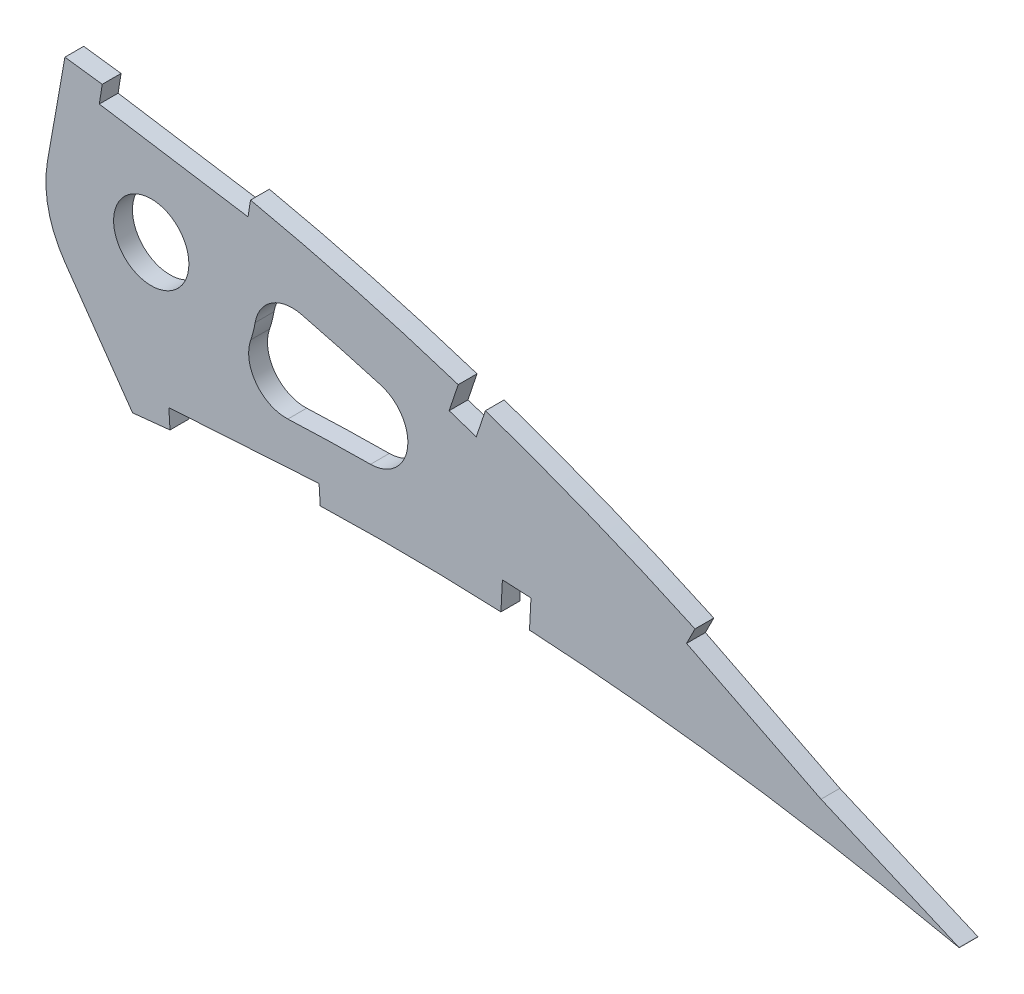
from build123d import *

# Parameters (mm, degrees)
BOSS_EXTRUDE1_DEPTH = 3.175
SKETCH5_R           = 6.35
CUT_EXTRUDE5_DEPTH  = 495.005666426
CUT_EXTRUDE6_DEPTH  = 7.62
FILLET1_R           = 6.35


with BuildPart() as part:
    # Sketch1 → Boss-Extrude1 (new body)
    with BuildSketch(Plane.XY):
        with BuildLine():
            Line((485.587399664, -0.75798934), (490.147728055, -1.684578565))
            Line((490.147728055, -1.684578565), (486.193791136, 0.75798934))
            add(Edge.make_bspline(
                [(486.193791136, 0.75798934), (486.156545565, 0.780998011), (486.007707871, 0.872943377), (485.672349582, 1.078647636), (485.113908292, 1.42125844), (484.332139179, 1.898395939), (483.327649378, 2.508793191), (482.099933618, 3.248176053), (480.649758178, 4.11414228), (478.977474042, 5.102596174), (477.083252712, 6.208909725), (474.9678154, 7.428600903), (472.631346146, 8.754764469), (470.074750091, 10.181981707), (467.298904376, 11.703464898), (464.304334104, 13.312342155), (461.092111509, 15.00042968), (457.663469746, 16.760467008), (454.019033833, 18.582734695), (450.160522056, 20.459648763), (446.08922006, 22.381851369), (441.806517314, 24.339086509), (437.314874314, 26.32337623), (432.615532729, 28.322383702), (427.711170694, 30.327448406), (422.603876177, 32.32715893), (417.296673201, 34.312408193), (411.791609239, 36.270335128), (406.092799427, 38.19238362), (400.203008281, 40.066067188), (394.126447785, 41.881210299), (387.866648542, 43.626044211), (381.42882875, 45.291620487), (374.81707141, 46.865809768), (368.036980395, 48.338075006), (361.093945075, 49.699552264), (353.993788332, 50.936649002), (346.7561854, 52.048400815), (339.497587697, 52.97319004), (332.253923966, 53.880196397), (325.021047815, 54.732245847), (317.699770737, 55.548201081), (310.297136308, 56.323468086), (302.820487344, 57.055622539), (295.277392798, 57.741504683), (287.675691417, 58.379102964), (280.022738792, 58.964804598), (272.326604726, 59.497707184), (264.594897726, 59.973125915), (256.835853078, 60.39070372), (249.05734719, 60.747528421), (241.267474913, 61.041141246), (233.474507978, 61.269769861), (225.686535745, 61.431223873), (217.911990598, 61.524488163), (210.158959277, 61.547014441), (202.435870244, 61.498399603), (194.750810842, 61.376974546), (187.112218127, 61.181076903), (179.528190462, 60.910341158), (172.006928802, 60.56488465), (164.556668167, 60.141814477), (157.185490761, 59.643826715), (149.90160498, 59.068829465), (142.713013757, 58.416669795), (135.627250794, 57.690066178), (128.652204991, 56.887042275), (121.795351463, 56.009883049), (115.064190238, 55.060308222), (108.466273869, 54.03780049), (102.008670179, 52.945313451), (95.69834878, 51.783964779), (89.541985966, 50.557159213), (83.546284377, 49.265216856), (77.717590812, 47.912013041), (72.061962755, 46.499905586), (66.585479912, 45.031479446), (61.293693841, 43.510258272), (56.191955701, 41.93969324), (51.286212878, 40.321510147), (46.580173058, 38.661844322), (42.079617138, 36.961873954), (37.787992638, 35.226836263), (33.71032906, 33.459100147), (29.849672544, 31.664054679), (26.210392495, 29.843743399), (22.795082621, 28.003266258), (19.607171667, 26.145445317), (16.649728276, 24.273731457), (13.923995526, 22.392872215), (11.433731376, 20.504048278), (9.179791317, 18.61203256), (7.163601692, 16.719706143), (5.388044474, 14.828372521), (3.853055719, 12.941362387), (2.560647106, 11.060170164), (1.511042845, 9.186575935), (0.706617001, 7.321940679), (0.14657185, 5.467313049), (-0.159993132, 3.625430402), (-0.236298987, 1.794816138), (-0.078648638, 0.597378122), (0, 0)],
                knots=[0, 0, 0, 0, 0.00025409, 0.001015373, 0.002283359, 0.004056577, 0.006330982, 0.009105274, 0.012374489, 0.016134023, 0.020379661, 0.025105976, 0.030306237, 0.035972206, 0.042099522, 0.048678064, 0.055701664, 0.063160184, 0.071045824, 0.079349827, 0.08806291, 0.097175757, 0.106678111, 0.116561573, 0.126814276, 0.137428301, 0.148393618, 0.15969976, 0.171338125, 0.183297699, 0.195569604, 0.208143556, 0.221011593, 0.234161831, 0.24758745, 0.261276822, 0.27522271, 0.289414144, 0.3037712, 0.317689226, 0.331784111, 0.346039677, 0.36044387, 0.374982721, 0.389640454, 0.404403317, 0.4192566, 0.434186749, 0.449177265, 0.464214782, 0.479284009, 0.49436974, 0.509457833, 0.524532346, 0.53957932, 0.554582984, 0.569529546, 0.584403417, 0.599190992, 0.613876838, 0.628447475, 0.642888675, 0.657186054, 0.671325546, 0.685294014, 0.699078147, 0.712665095, 0.726042645, 0.739197713, 0.752117586, 0.764792042, 0.777208152, 0.789355685, 0.80122396, 0.812803686, 0.824082909, 0.835054602, 0.845709571, 0.856037853, 0.866033834, 0.875688843, 0.884997719, 0.893953426, 0.902552897, 0.910789386, 0.918660734, 0.926166253, 0.933302626, 0.94007122, 0.94647478, 0.952517526, 0.958204819, 0.963546652, 0.9685566, 0.973249913, 0.977651041, 0.981787043, 0.985694226, 0.989415109, 0.993001157, 0.996508416, 1, 1, 1, 1], degree=3))
            add(Edge.make_bspline(
                [(0, 0), (0.124852845, -0.589388692), (0.375132337, -1.770874799), (1.055109044, -3.471725282), (1.954345773, -5.106735278), (3.091715472, -6.671561797), (4.459655687, -8.165777182), (6.055145152, -9.59093561), (7.876619233, -10.946270738), (9.92169391, -12.231165798), (12.187398396, -13.446984767), (14.671186068, -14.592971696), (17.370792198, -15.668768481), (20.283275494, -16.672937055), (23.405075375, -17.607006726), (26.733223776, -18.468701274), (30.263936284, -19.259225009), (33.993816996, -19.976560109), (37.918801514, -20.621435301), (42.034812323, -21.193489669), (46.337624631, -21.693081077), (50.82301706, -22.119161118), (55.4865531, -22.47264634), (60.323584549, -22.753771214), (65.329416188, -22.963427152), (70.499252954, -23.100817142), (75.828031579, -23.168083162), (81.310936338, -23.16623498), (86.942603653, -23.09477832), (92.718222737, -22.957660649), (98.632251256, -22.754013473), (104.679350026, -22.486301136), (110.854064483, -22.157217858), (117.150856575, -21.767879174), (123.564184912, -21.320010643), (130.088480981, -20.817203984), (136.717818035, -20.260713235), (143.446414433, -19.653782206), (150.268313286, -18.999449162), (157.177620607, -18.29978506), (164.168237687, -17.558081099), (171.233938121, -16.77674083), (178.368711149, -15.959932594), (185.566039209, -15.10913432), (192.819836156, -14.229203613), (200.123278023, -13.321821748), (207.470257634, -12.390483576), (214.854167095, -11.43957439), (222.268093801, -10.46898568), (229.705802131, -9.485632582), (237.16011938, -8.488705064), (244.624557097, -7.483330472), (252.092205531, -6.472633763), (259.555791095, -5.456925983), (267.00875308, -4.440416464), (274.444177456, -3.425895825), (281.854781181, -2.413456633), (289.233859631, -1.408131206), (296.573982386, -0.40979664), (303.868380953, 0.579523), (311.110065241, 1.55687475), (318.292203182, 2.521024953), (325.407385919, 3.471363717), (332.448454941, 4.408247897), (339.302915498, 5.303240759), (345.952856872, 6.204000824), (352.420688138, 6.942424504), (358.80798662, 7.572695641), (365.121387221, 8.089431053), (371.353308903, 8.500064921), (377.496611311, 8.807531395), (383.543972889, 9.016123146), (389.487754946, 9.132028332), (395.320533551, 9.158188245), (401.034347101, 9.102945563), (406.621764277, 8.970753247), (412.074986888, 8.767544827), (417.386407281, 8.500176147), (422.548480993, 8.175935919), (427.553458197, 7.799606866), (432.394364707, 7.379974648), (437.06373176, 6.923182232), (441.554389355, 6.434448486), (445.859785012, 5.92401425), (449.973027478, 5.395240442), (453.887929886, 4.85681652), (457.598190253, 4.314198878), (461.097932514, 3.774315295), (464.381658048, 3.242315892), (467.444062607, 2.72526199), (470.280349076, 2.227984348), (472.885595604, 1.755339323), (475.25618804, 1.313290259), (477.38744454, 0.904033197), (479.2765147, 0.534312721), (480.919885909, 0.205760173), (482.315149055, -0.076995438), (483.459867496, -0.312838295), (484.352302675, -0.497896754), (484.990691913, -0.632466588), (485.3743447, -0.712542465), (485.54480657, -0.748903783), (485.587399664, -0.75798934)],
                knots=[0, 0, 0, 0, 0.003638255, 0.007293231, 0.011028136, 0.014901081, 0.018963272, 0.023258475, 0.027820626, 0.032679082, 0.03785316, 0.043361875, 0.049214679, 0.055422346, 0.061988786, 0.068918036, 0.076211157, 0.083868392, 0.091887411, 0.100265912, 0.108999867, 0.118084529, 0.127514843, 0.13728527, 0.147387917, 0.157816481, 0.168563473, 0.179619128, 0.190977373, 0.202626974, 0.214560478, 0.226767249, 0.239236417, 0.251959004, 0.264923894, 0.278119703, 0.291536035, 0.30516028, 0.318980685, 0.332985499, 0.34716279, 0.361498603, 0.375980747, 0.390597192, 0.405332593, 0.420174823, 0.435109533, 0.450124276, 0.465203068, 0.480333154, 0.495500583, 0.510689775, 0.525887334, 0.541078314, 0.556247233, 0.571381785, 0.58646604, 0.601484516, 0.616424329, 0.631269423, 0.646006524, 0.660620684, 0.675098188, 0.689422858, 0.703581824, 0.716907564, 0.730009274, 0.742952128, 0.755725558, 0.768319952, 0.780724337, 0.792926528, 0.804916041, 0.816679084, 0.828203524, 0.8394749, 0.850481359, 0.861207697, 0.871639326, 0.881763414, 0.891563605, 0.901027364, 0.910138977, 0.918883976, 0.927249278, 0.935221104, 0.942784738, 0.949928188, 0.956638464, 0.962904204, 0.968712288, 0.974054485, 0.978918432, 0.983297218, 0.987180246, 0.990560674, 0.993433357, 0.995790626, 0.997629587, 0.998945816, 0.999736592, 1, 1, 1, 1], degree=3))
        make_face()
    extrude(amount=BOSS_EXTRUDE1_DEPTH)

    # Sketch5 → Cut-Extrude5 (cut, through all)
    with BuildSketch(Plane.XY.offset(3.175)):
        with BuildLine():
            ThreePointArc((339.268396528, 23.034385848), (336.474376869, 29.38427855), (336.323038027, 36.320039485))
            Line((336.323038027, 36.320039485), (339.264168094, 53.000016967))
            add(Edge.make_bspline(
                [(339.264168094, 53.000016967), (336.937656328, 53.293724364), (332.201167732, 53.886411202), (325.021047815, 54.732245847), (317.699770737, 55.548201081), (310.297136308, 56.323468086), (302.820487344, 57.055622539), (295.277392798, 57.741504683), (287.675691417, 58.379102964), (280.022738792, 58.964804598), (272.326604726, 59.497707184), (264.594897726, 59.973125915), (256.835853078, 60.39070372), (249.05734719, 60.747528421), (241.267474913, 61.041141246), (233.474507978, 61.269769861), (225.686535745, 61.431223873), (217.911990598, 61.524488163), (210.158959277, 61.547014441), (202.435870244, 61.498399603), (194.750810842, 61.376974546), (187.112218127, 61.181076903), (179.528190462, 60.910341158), (172.006928802, 60.56488465), (164.556668167, 60.141814477), (157.185490761, 59.643826715), (149.90160498, 59.068829465), (142.713013757, 58.416669795), (135.627250794, 57.690066178), (128.652204991, 56.887042275), (121.795351463, 56.009883049), (115.064190238, 55.060308222), (108.466273869, 54.03780049), (102.008670179, 52.945313451), (95.69834878, 51.783964779), (89.541985966, 50.557159213), (83.546284377, 49.265216856), (77.717590812, 47.912013041), (72.061962755, 46.499905586), (66.585479912, 45.031479446), (61.293693841, 43.510258272), (56.191955701, 41.93969324), (51.286212878, 40.321510147), (46.580173058, 38.661844322), (42.079617138, 36.961873954), (37.787992638, 35.226836263), (33.71032906, 33.459100147), (29.849672544, 31.664054679), (26.210392495, 29.843743399), (22.795082621, 28.003266258), (19.607171667, 26.145445317), (16.649728276, 24.273731457), (13.923995526, 22.392872215), (11.433731376, 20.504048278), (9.179791317, 18.61203256), (7.163601692, 16.719706143), (5.388044474, 14.828372521), (3.853055719, 12.941362387), (2.560647106, 11.060170164), (1.511042845, 9.186575935), (0.706617001, 7.321940679), (0.14657185, 5.467313049), (-0.159993132, 3.625430402), (-0.236298987, 1.794816138), (-0.078648638, 0.597378122), (0, 0)],
                knots=[0.304079504, 0.304079504, 0.304079504, 0.304079504, 0.317689226, 0.331784111, 0.346039677, 0.36044387, 0.374982721, 0.389640454, 0.404403317, 0.4192566, 0.434186749, 0.449177265, 0.464214782, 0.479284009, 0.49436974, 0.509457833, 0.524532346, 0.53957932, 0.554582984, 0.569529546, 0.584403417, 0.599190992, 0.613876838, 0.628447475, 0.642888675, 0.657186054, 0.671325546, 0.685294014, 0.699078147, 0.712665095, 0.726042645, 0.739197713, 0.752117586, 0.764792042, 0.777208152, 0.789355685, 0.80122396, 0.812803686, 0.824082909, 0.835054602, 0.845709571, 0.856037853, 0.866033834, 0.875688843, 0.884997719, 0.893953426, 0.902552897, 0.910789386, 0.918660734, 0.926166253, 0.933302626, 0.94007122, 0.94647478, 0.952517526, 0.958204819, 0.963546652, 0.9685566, 0.973249913, 0.977651041, 0.981787043, 0.985694226, 0.989415109, 0.993001157, 0.996508416, 1, 1, 1, 1], degree=3))
            add(Edge.make_bspline(
                [(0, 0), (0.124852845, -0.589388692), (0.375132337, -1.770874799), (1.055109044, -3.471725282), (1.954345773, -5.106735278), (3.091715472, -6.671561797), (4.459655687, -8.165777182), (6.055145152, -9.59093561), (7.876619233, -10.946270738), (9.92169391, -12.231165798), (12.187398396, -13.446984767), (14.671186068, -14.592971696), (17.370792198, -15.668768481), (20.283275494, -16.672937055), (23.405075375, -17.607006726), (26.733223776, -18.468701274), (30.263936284, -19.259225009), (33.993816996, -19.976560109), (37.918801514, -20.621435301), (42.034812323, -21.193489669), (46.337624631, -21.693081077), (50.82301706, -22.119161118), (55.4865531, -22.47264634), (60.323584549, -22.753771214), (65.329416188, -22.963427152), (70.499252954, -23.100817142), (75.828031579, -23.168083162), (81.310936338, -23.16623498), (86.942603653, -23.09477832), (92.718222737, -22.957660649), (98.632251256, -22.754013473), (104.679350026, -22.486301136), (110.854064483, -22.157217858), (117.150856575, -21.767879174), (123.564184912, -21.320010643), (130.088480981, -20.817203984), (136.717818035, -20.260713235), (143.446414433, -19.653782206), (150.268313286, -18.999449162), (157.177620607, -18.29978506), (164.168237687, -17.558081099), (171.233938121, -16.77674083), (178.368711149, -15.959932594), (185.566039209, -15.10913432), (192.819836156, -14.229203613), (200.123278023, -13.321821748), (207.470257634, -12.390483576), (214.854167095, -11.43957439), (222.268093801, -10.46898568), (229.705802131, -9.485632582), (237.16011938, -8.488705064), (244.624557097, -7.483330472), (252.092205531, -6.472633763), (259.555791095, -5.456925983), (267.00875308, -4.440416464), (274.444177456, -3.425895825), (281.854781181, -2.413456633), (289.233859631, -1.408131206), (296.573982386, -0.40979664), (303.868380953, 0.579523), (311.110065241, 1.55687475), (318.292203182, 2.521024953), (325.407385919, 3.471363717), (332.448454941, 4.408247897), (339.302915498, 5.303240759), (345.365279013, 6.124411149), (349.116343239, 6.563474717), (350.680088226, 6.736801095)],
                knots=[0, 0, 0, 0, 0.003638255, 0.007293231, 0.011028136, 0.014901081, 0.018963272, 0.023258475, 0.027820626, 0.032679082, 0.03785316, 0.043361875, 0.049214679, 0.055422346, 0.061988786, 0.068918036, 0.076211157, 0.083868392, 0.091887411, 0.100265912, 0.108999867, 0.118084529, 0.127514843, 0.13728527, 0.147387917, 0.157816481, 0.168563473, 0.179619128, 0.190977373, 0.202626974, 0.214560478, 0.226767249, 0.239236417, 0.251959004, 0.264923894, 0.278119703, 0.291536035, 0.30516028, 0.318980685, 0.332985499, 0.34716279, 0.361498603, 0.375980747, 0.390597192, 0.405332593, 0.420174823, 0.435109533, 0.450124276, 0.465203068, 0.480333154, 0.495500583, 0.510689775, 0.525887334, 0.541078314, 0.556247233, 0.571381785, 0.58646604, 0.601484516, 0.616424329, 0.631269423, 0.646006524, 0.660620684, 0.675098188, 0.689422858, 0.703581824, 0.716907564, 0.726423125, 0.726423125, 0.726423125, 0.726423125], degree=3))
            Line((350.680088226, 6.736801095), (339.268396528, 23.034385848))
        make_face()
        with Locations((353.832919875, 33.232574886)):
            Circle(SKETCH5_R)
        with BuildLine():
            add(Edge.make_bspline(
                [(431.792204981, 17.627124909), (429.499446283, 18.60875342), (417.537197355, 23.583145799), (400.38239885, 29.636231351), (382.285825986, 34.651124284), (374.18178654, 36.577831496), (371.152246999, 37.253682689)],
                knots=[0.11000544, 0.11000544, 0.11000544, 0.11000544, 0.124891408, 0.187337113, 0.218559965, 0.237120282, 0.237120282, 0.237120282, 0.237120282], degree=3))
            ThreePointArc((371.152246999, 37.253682689), (371.497376225, 35.256279871), (371.612919875, 33.232574886))
            ThreePointArc((371.612919875, 33.232574886), (369.366310929, 24.581438407), (363.194228944, 18.116547216))
            add(Edge.make_bspline(
                [(363.194228944, 18.116547216), (367.949696757, 18.482461612), (377.992772166, 19.074473867), (398.645234284, 19.522094037), (416.768618232, 18.862166517), (429.549739053, 17.826232335), (431.792204981, 17.627124909)],
                knots=[0.753339218, 0.753339218, 0.753339218, 0.753339218, 0.781447924, 0.812669649, 0.875113099, 0.888413857, 0.888413857, 0.888413857, 0.888413857], degree=3))
        make_face()
    extrude(amount=-CUT_EXTRUDE5_DEPTH, mode=Mode.SUBTRACT)

    # Sketch6 → Cut-Extrude6 (cut)
    with BuildSketch(Plane(origin=(0, 0, 0), x_dir=(-1, 0, 0), z_dir=(0, 0, -1))):
        Polygon((-417.650295847, 8.475310149), (-417.650295847, 7.612206053), (-412.830655019, 7.859821957), (-412.830655019, 8.722926053), (-413.078270924, 13.54256688), (-417.897911751, 13.294950976), align=None)
        Polygon((-491.421363462, 1.231455898), (-468.179228096, 11.238892945), (-445.576649003, 22.617331862), (-444.149007278, 19.781408127), (-466.83639716, 8.36027433), (-490.165740173, -1.684711979), align=None)
        Polygon((-382.347442541, 8.975869989), (-382.347442541, 7.859821957), (-356.997242094, 6.290346225), (-356.997242094, 7.386352148), (-356.798552364, 10.555127204), (-382.14875281, 12.144645045), align=None)
        Polygon((-408.674358859, 32.228266711), (-410.201609569, 36.806230537), (-405.623645744, 38.333481247), (-404.096395034, 33.755517421), align=None)
        Polygon((-370.162778652, 45.112121424), (-370.654947588, 48.248742176), (-345.561981574, 52.186093662), (-345.069812638, 49.04947291), align=None)
    extrude(amount=-CUT_EXTRUDE6_DEPTH, mode=Mode.SUBTRACT)


with BuildPart() as cut_extrude6_kept_piece:
    # of the separate pieces the step leaves, the one the design keeps (cut_extrude6_pieces_kept)
    add(part.part.solids().sort_by_distance((485.587399664, -0.75798934, 0))[0])

    # Fillet1
    fillet1_edges = [cut_extrude6_kept_piece.edges().sort_by_distance(p)[0] for p in [
        (431.792204981, 17.627124909, 1.5875),
        (363.194228944, 18.116547216, 1.5875),
        (371.152246999, 37.253682689, 1.5875),
    ]]
    fillet(fillet1_edges, radius=FILLET1_R)


solid = cut_extrude6_kept_piece.part
